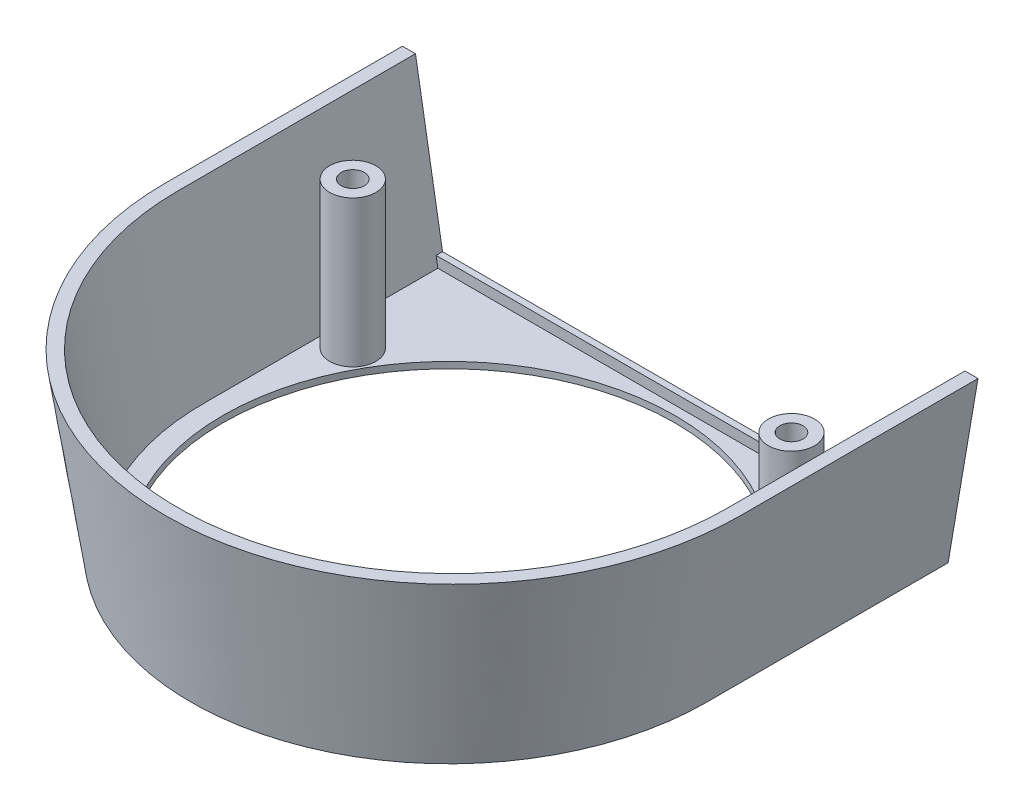
from build123d import *

# Parameters (mm, degrees)
SKETCH3_R                 = 44
BOSS_EXTRUDE1_DEPTH       = 1.25
SKETCH4_W                 = 100.44
SKETCH4_H                 = 1.25
BOSS_EXTRUDE2_DEPTH       = 2
BOSS_EXTRUDE3_OUTLINE_R   = 4.5
BOSS_EXTRUDE3_OUTLINE_R_2 = 2.25
BOSS_EXTRUDE3_DEPTH       = 28.5


with BuildPart() as part:
    # Sketch1 → Loft1 section 0
    with BuildSketch(Plane(origin=(0, 0, 0), x_dir=(1, 0, 0), z_dir=(0, 1, 0))):
        with BuildLine():
            Line((47.68, 0), (47.68, -47))
            ThreePointArc((47.68, -47), (0, -94.68), (-47.68, -47))
            Line((-47.68, -47), (-47.68, 0))
            Line((-47.68, 0), (-50.22, 0))
            Line((-50.22, 0), (-50.22, -47))
            ThreePointArc((-50.22, -47), (0, -97.22), (50.22, -47))
            Line((50.22, -47), (50.22, 0))
            Line((50.22, 0), (47.68, 0))
        make_face()
    # Sketch2 → Loft1 section 1
    with BuildSketch(Plane(origin=(0, 34, 0), x_dir=(1, 0, 0), z_dir=(0, 1, 0))):
        with BuildLine():
            Line((-56.04, 0), (-56.04, -46.2))
            ThreePointArc((-56.04, -46.2), (0, -102.24), (56.04, -46.2))
            Line((56.04, -46.2), (56.04, 0))
            Line((56.04, 0), (53.5, 0))
            Line((53.5, 0), (53.5, -46.2))
            ThreePointArc((53.5, -46.2), (0, -99.7), (-53.5, -46.2))
            Line((-53.5, -46.2), (-53.5, 0))
            Line((-53.5, 0), (-56.04, 0))
        make_face()
    loft()

    # Sketch3 → Boss-Extrude1 (add)
    with BuildSketch(Plane.XZ):
        with BuildLine():
            Line((-50.219775987, 0), (50.219775987, 0))
            Line((50.219775987, 0), (50.219775987, 46.850000669))
            ThreePointArc((50.219775987, 46.850000669), (0, 96.920001338), (-50.219775987, 46.850000669))
            Line((-50.219775987, 46.850000669), (-50.219775987, 0))
        make_face()
        with Locations(Location((0, 47, 0), (0, 0, 270))):
            Circle(SKETCH3_R, mode=Mode.SUBTRACT)
    extrude(amount=-BOSS_EXTRUDE1_DEPTH)

    # Sketch4 → Boss-Extrude2 (add)
    with BuildSketch(Plane(origin=(0, 1.25, 0), x_dir=(1, 0, 0), z_dir=(0, 1, 0))):
        with Locations((0, -0.625)):
            Rectangle(SKETCH4_W, SKETCH4_H)
    extrude(amount=BOSS_EXTRUDE2_DEPTH)

    # Boss-Extrude3: read off the stored shape, not the designer's step
    # Boss-Extrude3 outline → Boss-Extrude3 (add)
    with BuildSketch(Plane(origin=(0, 1.25, 0), x_dir=(1, 0, 0), z_dir=(0, 1, 0))):
        with Locations((-42.713936364, -23)):
            Circle(BOSS_EXTRUDE3_OUTLINE_R)
        with Locations((-42.713936364, -23)):
            Circle(BOSS_EXTRUDE3_OUTLINE_R_2, mode=Mode.SUBTRACT)
    boss_extrude3 = extrude(amount=BOSS_EXTRUDE3_DEPTH)

    # Mirror1: Boss-Extrude3 across plane
    add(boss_extrude3.mirror(Plane(origin=(0, 0, 0), x_dir=(0, 0, 1), z_dir=(1, 0, 0))))


solid = part.part
